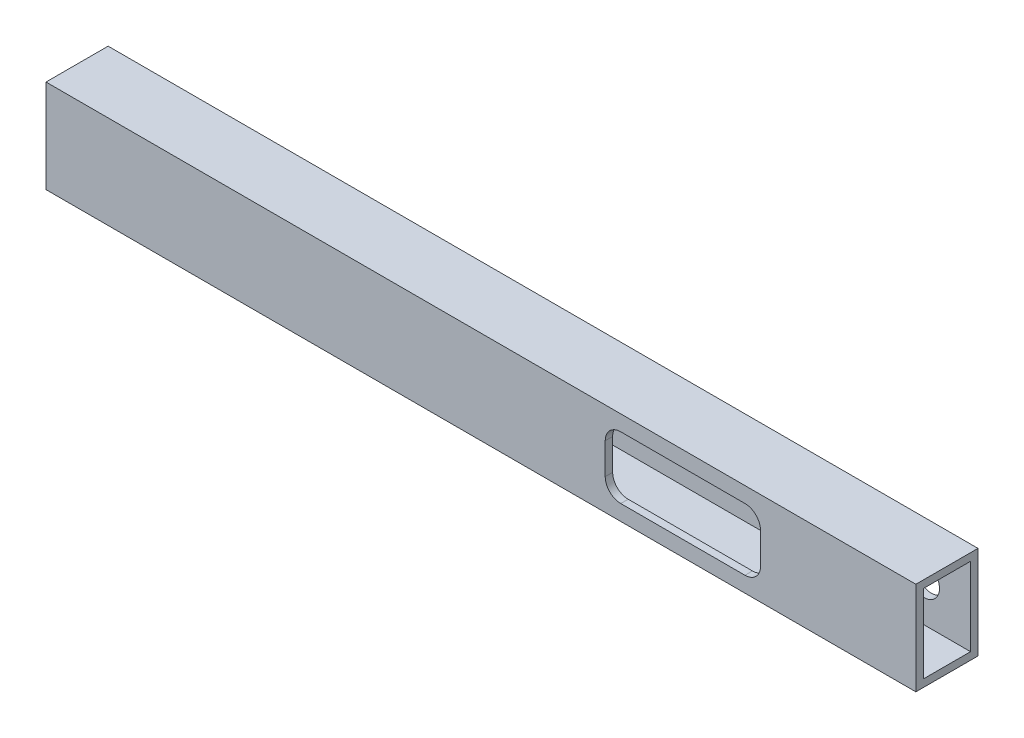
from build123d import *

# Parameters (mm, degrees)
SKETCH1_W           = 25.4
SKETCH1_H           = 38.1
SKETCH1_W_2         = 19.304
SKETCH1_H_2         = 32.004
BOSS_EXTRUDE1_DEPTH = 355.6
CUT_EXTRUDE1_REACH  = 359.015
SKETCH2_R           = 6.35
CUT_EXTRUDE2_REACH  = 359.015
SKETCH3_R           = 3.175
CUT_EXTRUDE3_REACH  = 359.015


with BuildPart() as part:
    # Sketch1 → Boss-Extrude1 (new body)
    with BuildSketch(Plane(origin=(0, 0, 0), x_dir=(0, 0, -1), z_dir=(1, 0, 0))):
        Rectangle(SKETCH1_W, SKETCH1_H)
        Rectangle(SKETCH1_W_2, SKETCH1_H_2, mode=Mode.SUBTRACT)
    extrude(amount=BOSS_EXTRUDE1_DEPTH)

    # Sketch2 → Cut-Extrude1 (cut, up to next)
    with BuildSketch(Plane(origin=(0, 0, -12.7), x_dir=(-1, 0, 0), z_dir=(0, 0, -1)), mode=Mode.PRIVATE) as cut_extrude1_sk1:
        with Locations((-336.55, 0)):
            Circle(SKETCH2_R)
    cut_extrude1_tool1 = extrude(cut_extrude1_sk1.sketch, amount=-CUT_EXTRUDE1_REACH, mode=Mode.PRIVATE) & part.part
    add(cut_extrude1_tool1.solids().sort_by_distance((336.55, 0, -12.7))[0], mode=Mode.SUBTRACT)

    # Sketch3 → Cut-Extrude2 (cut, up to next)
    with BuildSketch(Plane(origin=(0, 0, -12.7), x_dir=(-1, 0, 0), z_dir=(0, 0, -1)), mode=Mode.PRIVATE) as cut_extrude2_sk1:
        with Locations((-260.35, 0)):
            Circle(SKETCH3_R)
    cut_extrude2_tool1 = extrude(cut_extrude2_sk1.sketch, amount=-CUT_EXTRUDE2_REACH, mode=Mode.PRIVATE) & part.part
    add(cut_extrude2_tool1.solids().sort_by_distance((260.35, 0, -12.7))[0], mode=Mode.SUBTRACT)

    # Sketch4 → Cut-Extrude3 (cut, up to next)
    with BuildSketch(Plane.XY.offset(12.7), mode=Mode.PRIVATE) as cut_extrude3_sk1:
        with BuildLine():
            Line((234.95, -12.7), (285.75, -12.7))
            ThreePointArc((285.75, -12.7), (290.240128061, -10.840128061), (292.1, -6.35))
            Line((292.1, -6.35), (292.1, 6.35))
            ThreePointArc((292.1, 6.35), (290.240128061, 10.840128061), (285.75, 12.7))
            Line((285.75, 12.7), (234.95, 12.7))
            ThreePointArc((234.95, 12.7), (230.459871939, 10.840128061), (228.6, 6.35))
            Line((228.6, 6.35), (228.6, -6.35))
            ThreePointArc((228.6, -6.35), (230.459871939, -10.840128061), (234.95, -12.7))
        make_face()
    cut_extrude3_tool1 = extrude(cut_extrude3_sk1.sketch, amount=-CUT_EXTRUDE3_REACH, mode=Mode.PRIVATE) & part.part
    add(cut_extrude3_tool1.solids().sort_by_distance((260.35, 0, 12.7))[0], mode=Mode.SUBTRACT)


solid = part.part
